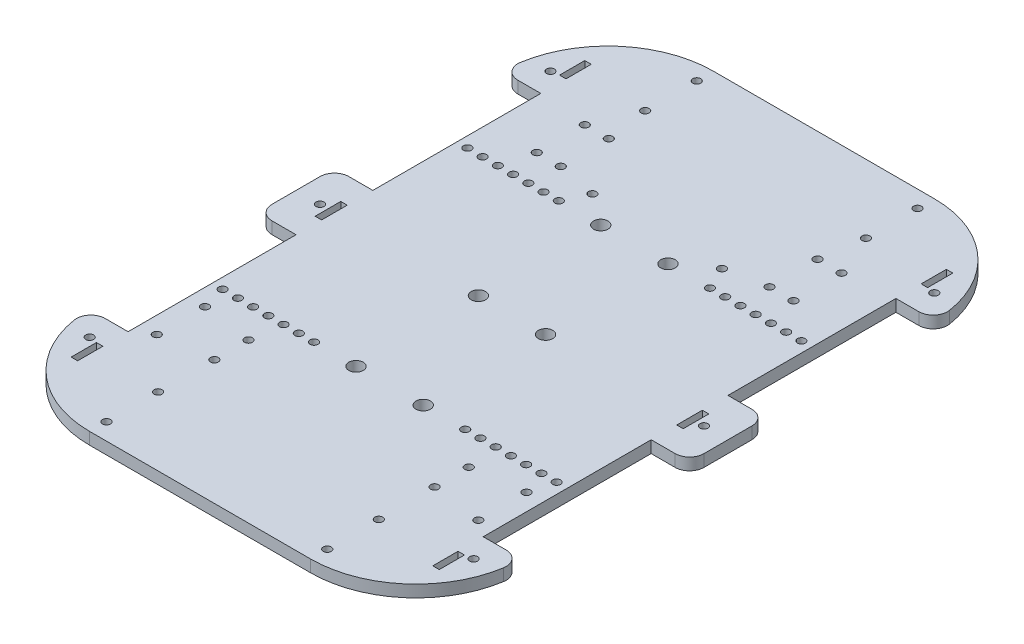
from build123d import *

# Parameters (mm, degrees)
SKETCH2_W           = 2.7
SKETCH2_H           = 10.51
SKETCH2_H_2         = 10.666666666
BOSS_EXTRUDE4_DEPTH = 5
SKETCH5_R           = 1.65
SKETCH5_R_2         = 3
CUT_EXTRUDE1_DEPTH  = 159.192920196


with BuildPart() as part:
    # Sketch2 → Boss-Extrude4 (new body)
    with BuildSketch(Plane(origin=(0, 0, 0), x_dir=(1, 0, 0), z_dir=(0, 1, 0))):
        with BuildLine():
            Line((46, -130), (-46, -130))
            ThreePointArc((-46, -130), (-74.550970119, -119.478980051), (-89.448061775, -92.947368421))
            ThreePointArc((-89.448061775, -92.947368421), (-88.08864154, -88.106685893), (-83.523326079, -86))
            Line((-83.523326079, -86), (-74, -86))
            Line((-74, -86), (-74, -16))
            Line((-74, -16), (-84, -16))
            ThreePointArc((-84, -16), (-88.242640687, -14.242640687), (-90, -10))
            Line((-90, -10), (-90, 10))
            ThreePointArc((-90, 10), (-88.242640687, 14.242640687), (-84, 16))
            Line((-84, 16), (-74, 16))
            Line((-74, 16), (-74, 86))
            Line((-74, 86), (-83.523326079, 86))
            ThreePointArc((-83.523326079, 86), (-88.08864154, 88.106685893), (-89.448061775, 92.947368421))
            ThreePointArc((-89.448061775, 92.947368421), (-74.550970119, 119.478980051), (-46, 130))
            Line((-46, 130), (46, 130))
            ThreePointArc((46, 130), (74.550970119, 119.478980051), (89.448061775, 92.947368421))
            ThreePointArc((89.448061775, 92.947368421), (88.08864154, 88.106685893), (83.523326079, 86))
            Line((83.523326079, 86), (74, 86))
            Line((74, 86), (74, 16))
            Line((74, 16), (84, 16))
            ThreePointArc((84, 16), (88.242640687, 14.242640687), (90, 10))
            Line((90, 10), (90, -10))
            ThreePointArc((90, -10), (88.242640687, -14.242640687), (84, -16))
            Line((84, -16), (74, -16))
            Line((74, -16), (74, -86))
            Line((74, -86), (83.523326079, -86))
            ThreePointArc((83.523326079, -86), (88.08864154, -88.106685893), (89.448061775, -92.947368421))
            ThreePointArc((89.448061775, -92.947368421), (74.550970119, -119.478980051), (46, -130))
        make_face()
        with Locations((-75.35, 101.765)):
            Rectangle(SKETCH2_W, SKETCH2_H, mode=Mode.SUBTRACT)
        with Locations((75.35, 101.765)):
            Rectangle(SKETCH2_W, SKETCH2_H, mode=Mode.SUBTRACT)
        with Locations((75.35, -101.765)):
            Rectangle(SKETCH2_W, SKETCH2_H, mode=Mode.SUBTRACT)
        with Locations((-75.35, -101.765)):
            Rectangle(SKETCH2_W, SKETCH2_H, mode=Mode.SUBTRACT)
        with Locations((-75.35, 0)):
            Rectangle(SKETCH2_W, SKETCH2_H_2, mode=Mode.SUBTRACT)
        with Locations((75.35, 0)):
            Rectangle(SKETCH2_W, SKETCH2_H_2, mode=Mode.SUBTRACT)
    extrude(amount=BOSS_EXTRUDE4_DEPTH)

    # Sketch5 → Cut-Extrude1 (cut, through all)
    with BuildSketch(Plane(origin=(0, 5, 0), x_dir=(1, 0, 0), z_dir=(0, 1, 0))):
        with Locations((-69.6, -51)):
            Circle(SKETCH5_R)
        with Locations((-63.25, -51)):
            Circle(SKETCH5_R)
        with Locations((-56.9, -51)):
            Circle(SKETCH5_R)
        with Locations((-50.55, -51)):
            Circle(SKETCH5_R)
        with Locations((-44.2, -51)):
            Circle(SKETCH5_R)
        with Locations((-37.85, -51)):
            Circle(SKETCH5_R)
        with Locations((-31.5, -51)):
            Circle(SKETCH5_R)
        with Locations((31.5, -51)):
            Circle(SKETCH5_R)
        with Locations((37.85, -51)):
            Circle(SKETCH5_R)
        with Locations((44.2, -51)):
            Circle(SKETCH5_R)
        with Locations((50.55, -51)):
            Circle(SKETCH5_R)
        with Locations((56.9, -51)):
            Circle(SKETCH5_R)
        with Locations((63.25, -51)):
            Circle(SKETCH5_R)
        with Locations((69.6, -51)):
            Circle(SKETCH5_R)
        with Locations((69.6, 51)):
            Circle(SKETCH5_R)
        with Locations((63.25, 51)):
            Circle(SKETCH5_R)
        with Locations((56.9, 51)):
            Circle(SKETCH5_R)
        with Locations((50.55, 51)):
            Circle(SKETCH5_R)
        with Locations((44.2, 51)):
            Circle(SKETCH5_R)
        with Locations((37.85, 51)):
            Circle(SKETCH5_R)
        with Locations((31.5, 51)):
            Circle(SKETCH5_R)
        with Locations((-31.5, 51)):
            Circle(SKETCH5_R)
        with Locations((-37.85, 51)):
            Circle(SKETCH5_R)
        with Locations((-44.2, 51)):
            Circle(SKETCH5_R)
        with Locations((-50.55, 51)):
            Circle(SKETCH5_R)
        with Locations((-56.9, 51)):
            Circle(SKETCH5_R)
        with Locations((-63.25, 51)):
            Circle(SKETCH5_R)
        with Locations((-69.6, 51)):
            Circle(SKETCH5_R)
        with Locations((-14, -51)):
            Circle(SKETCH5_R_2)
        with Locations((14, -51)):
            Circle(SKETCH5_R_2)
        with Locations((14, 51)):
            Circle(SKETCH5_R_2)
        with Locations((-14, 51)):
            Circle(SKETCH5_R_2)
        with Locations((-14, 0)):
            Circle(SKETCH5_R_2)
        with Locations((14, 0)):
            Circle(SKETCH5_R_2)
        with Locations((-80, 96)):
            Circle(SKETCH5_R)
        with Locations((-80, 0)):
            Circle(SKETCH5_R)
        with Locations((80, 0)):
            Circle(SKETCH5_R)
        with Locations((-80, -96)):
            Circle(SKETCH5_R)
        with Locations((80, -96)):
            Circle(SKETCH5_R)
        with Locations((80, 96)):
            Circle(SKETCH5_R)
        with Locations((-53.5, 83.83)):
            Circle(SKETCH5_R)
        with Locations((-53.5, 63.83)):
            Circle(SKETCH5_R)
        with Locations((-43.5, 63.83)):
            Circle(SKETCH5_R)
        with Locations((-43.5, 83.83)):
            Circle(SKETCH5_R)
        with Locations((43.5, 63.83)):
            Circle(SKETCH5_R)
        with Locations((53.5, 63.83)):
            Circle(SKETCH5_R)
        with Locations((43.5, 83.83)):
            Circle(SKETCH5_R)
        with Locations((53.5, 83.83)):
            Circle(SKETCH5_R)
        with Locations((-46, 123)):
            Circle(SKETCH5_R)
        with Locations((-46, 101.5)):
            Circle(SKETCH5_R)
        with Locations((46, 101.5)):
            Circle(SKETCH5_R)
        with Locations((46, 123)):
            Circle(SKETCH5_R)
        with Locations((-67, -60.960027583)):
            Circle(SKETCH5_R)
        with Locations((-45.897115189, -63.923125828)):
            Circle(SKETCH5_R)
        with Locations((-67, -81.039972417)):
            Circle(SKETCH5_R)
        with Locations((-45.897115189, -78.156819007)):
            Circle(SKETCH5_R)
        with Locations((45.897115189, -63.923125828)):
            Circle(SKETCH5_R)
        with Locations((45.897115189, -78.156819007)):
            Circle(SKETCH5_R)
        with Locations((67, -81.039972417)):
            Circle(SKETCH5_R)
        with Locations((67, -60.960027583)):
            Circle(SKETCH5_R)
        with Locations((46, -123)):
            Circle(SKETCH5_R)
        with Locations((46, -101.5)):
            Circle(SKETCH5_R)
        with Locations((-46, -101.5)):
            Circle(SKETCH5_R)
        with Locations((-46, -123)):
            Circle(SKETCH5_R)
        with Locations((-27, 60.5)):
            Circle(SKETCH5_R)
        with Locations((27, 60.5)):
            Circle(SKETCH5_R)
    extrude(amount=-CUT_EXTRUDE1_DEPTH, mode=Mode.SUBTRACT)


solid = part.part
